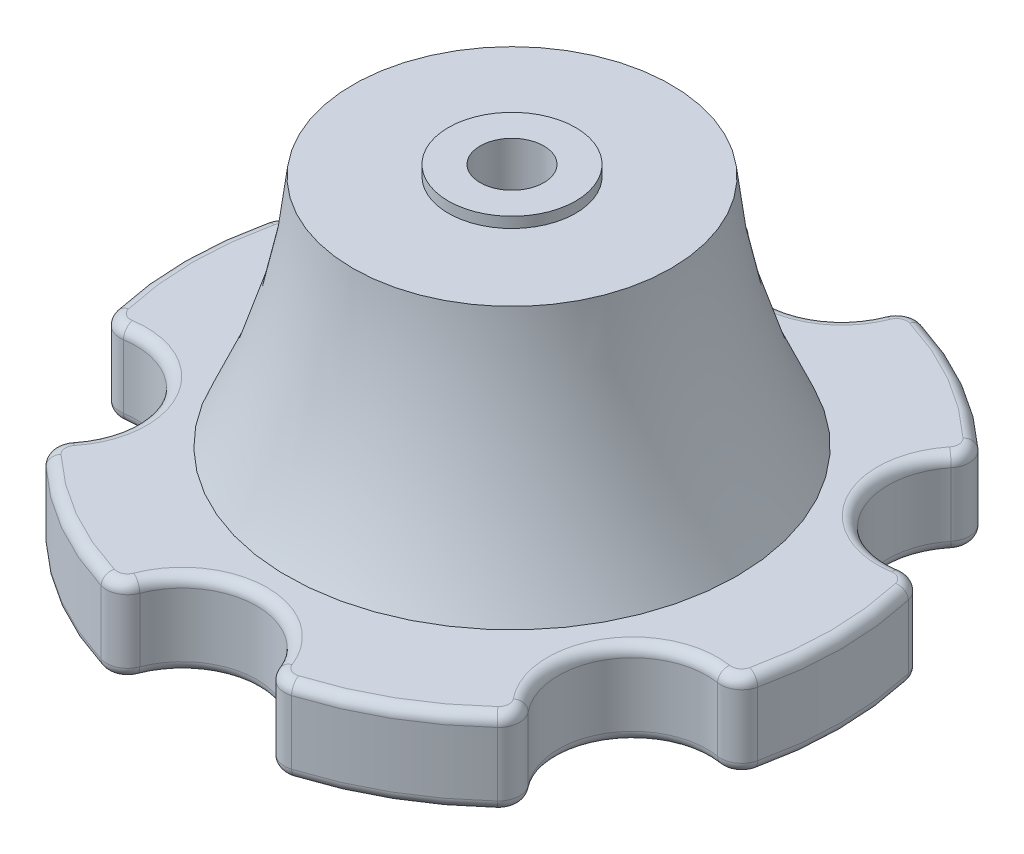
from build123d import *

# Parameters (mm, degrees)
EXTRUDE_1_DEPTH     = 15
SKETCH_3_R          = 1.5
CUT_EXTRUDE_1_DEPTH = 15
CUT_EXTRUDE_2_DEPTH = 4
FILLET_1_R          = 1
FILLET_2_R          = 0.5
SKETCH_5_R          = 3
SKETCH_5_R_2        = 1.5
EXTRUDE_2_DEPTH     = 0.5


with BuildPart() as part:
    # Эскиз1 → Бобышка-Вытянуть1 (new body)
    with BuildSketch(Plane(origin=(0, 0, 0), x_dir=(1, 0, 0), z_dir=(0, 1, 0))):
        with BuildLine():
            ThreePointArc((-3.477707616, 15.135602061), (0, 12.03), (3.477707616, 15.135602061))
            ThreePointArc((3.477707616, 15.135602061), (7.765, 13.449374521), (11.368962078, 10.579584173))
            ThreePointArc((11.368962078, 10.579584173), (10.418285608, 6.015), (14.846669694, 4.556017888))
            ThreePointArc((14.846669694, 4.556017888), (15.53, 0), (14.846669694, -4.556017888))
            ThreePointArc((14.846669694, -4.556017888), (10.418285608, -6.015), (11.368962078, -10.579584173))
            ThreePointArc((11.368962078, -10.579584173), (7.765, -13.449374521), (3.477707616, -15.135602061))
            ThreePointArc((3.477707616, -15.135602061), (0, -12.03), (-3.477707616, -15.135602061))
            ThreePointArc((-3.477707616, -15.135602061), (-7.765, -13.449374521), (-11.368962078, -10.579584173))
            ThreePointArc((-11.368962078, -10.579584173), (-10.418285608, -6.015), (-14.846669694, -4.556017888))
            ThreePointArc((-14.846669694, -4.556017888), (-15.53, 0), (-14.846669694, 4.556017888))
            ThreePointArc((-14.846669694, 4.556017888), (-10.418285608, 6.015), (-11.368962078, 10.579584173))
            ThreePointArc((-11.368962078, 10.579584173), (-7.765, 13.449374521), (-3.477707616, 15.135602061))
        make_face()
    extrude(amount=EXTRUDE_1_DEPTH)

    # Эскиз2 → Вырез-Повернуть1 (revolve, cut)
    with BuildSketch(Plane.XY):
        with BuildLine():
            Line((-15.6, 31), (-15.6, 4))
            Line((-15.6, 4), (-10.6, 4))
            ThreePointArc((-10.6, 4), (-7.390856649, 17.5), (-10.6, 31))
            Line((-10.6, 31), (-15.6, 31))
        make_face()
    revolve(axis=Axis((0, -1000, 0), (0, 1, 0)), mode=Mode.SUBTRACT)

    # Эскиз3 → Вырез-Вытянуть1 (cut)
    with BuildSketch(Plane.XZ):
        Circle(SKETCH_3_R)
    extrude(amount=-CUT_EXTRUDE_1_DEPTH, mode=Mode.SUBTRACT)

    # Эскиз4 → Вырез-Вытянуть2 (cut)
    with BuildSketch(Plane.XZ):
        Polygon((1.58771324, 2.75), (-1.58771324, 2.75), (-3.175426481, 0), (-1.58771324, -2.75), (1.58771324, -2.75), (3.175426481, 0), align=None)
    extrude(amount=-CUT_EXTRUDE_2_DEPTH, mode=Mode.SUBTRACT)

    # Скругление1
    fillet_1_edges = [part.edges().sort_by_distance(p)[0] for p in [
        (-3.477707616, 2, -15.135602061),
        (-11.368962078, 2, -10.579584173),
        (3.477707616, 2, -15.135602061),
        (11.368962078, 2, -10.579584173),
        (14.846669694, 2, -4.556017888),
        (14.846669694, 2, 4.556017888),
        (11.368962078, 2, 10.579584173),
        (3.477707616, 2, 15.135602061),
        (-3.477707616, 2, 15.135602061),
        (-14.846669694, 2, -4.556017888),
        (-11.368962078, 2, 10.579584173),
        (-14.846669694, 2, 4.556017888),
    ]]
    fillet(fillet_1_edges, radius=FILLET_1_R)

    # Скругление2
    fillet_2_edges = [part.edges().sort_by_distance(p)[0] for p in [
        (10.418285608, 4, 6.015),
        (10.945056155, 4, 10.659830131),
        (7.765, 4, 13.449374521),
        (3.759155616, 4, 14.808611742),
        (0, 4, 12.03),
        (-3.759155616, 4, 14.808611742),
        (-7.765, 4, 13.449374521),
        (-10.945056155, 4, 10.659830131),
        (-10.418285608, 4, 6.015),
        (-14.704211771, 4, 4.148781611),
        (-15.53, 4, 0),
        (-14.704211771, 4, -4.148781611),
        (-10.418285608, 4, -6.015),
        (-10.945056155, 4, -10.659830131),
        (-7.765, 4, -13.449374521),
        (-3.759155616, 4, -14.808611742),
        (0, 4, -12.03),
        (3.759155616, 4, -14.808611742),
        (7.765, 4, -13.449374521),
        (10.945056155, 4, -10.659830131),
        (10.418285608, 4, -6.015),
        (14.704211771, 4, -4.148781611),
        (15.53, 4, 0),
        (-14.704211771, 0, -4.148781611),
        (-10.418285608, 0, -6.015),
        (-10.945056155, 0, -10.659830131),
        (-7.765, 0, -13.449374521),
        (-3.759155616, 0, -14.808611742),
        (0, 0, -12.03),
        (3.759155616, 0, -14.808611742),
        (7.765, 0, -13.449374521),
        (10.945056155, 0, -10.659830131),
        (10.418285608, 0, -6.015),
        (14.704211771, 0, -4.148781611),
        (15.53, 0, 0),
        (14.704211771, 0, 4.148781611),
        (10.418285608, 0, 6.015),
        (10.945056155, 0, 10.659830131),
        (7.765, 0, 13.449374521),
        (3.759155616, 0, 14.808611742),
        (0, 0, 12.03),
        (-3.759155616, 0, 14.808611742),
        (-7.765, 0, 13.449374521),
        (-10.945056155, 0, 10.659830131),
        (-10.418285608, 0, 6.015),
        (-14.704211771, 0, 4.148781611),
        (14.704211771, 4, 4.148781611),
        (-15.53, 0, 0),
    ]]
    fillet(fillet_2_edges, radius=FILLET_2_R)

    # Эскиз5 → Бобышка-Вытянуть2 (add)
    with BuildSketch(Plane(origin=(0, 15, 0), x_dir=(1, 0, 0), z_dir=(0, 1, 0))):
        Circle(SKETCH_5_R)
        Circle(SKETCH_5_R_2, mode=Mode.SUBTRACT)
    extrude(amount=EXTRUDE_2_DEPTH)


solid = part.part
